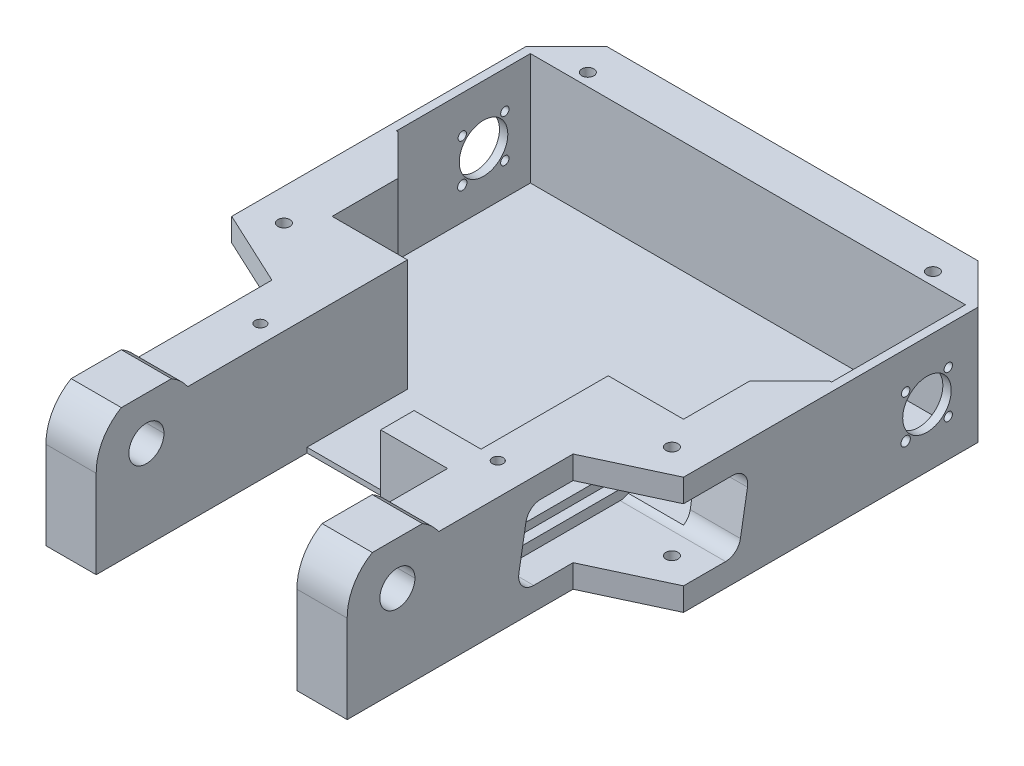
from build123d import *

# Parameters (mm, degrees)
BOSS_EXTRUDE1_DEPTH      = 30
BOSS_EXTRUDE2_DEPTH      = 5
BOSS_EXTRUDE3_DEPTH      = 15
BOSS_EXTRUDE6_START      = -75
BOSS_EXTRUDE6_DEPTH      = 15
CUT_EXTRUDE17_DEPTH      = 121.571555518
CUT_EXTRUDE17_DEPTH_BACK = 121.571555518
SKETCH5_R                = 5.25
CUT_EXTRUDE1_DEPTH       = 100
SKETCH6_W                = 40
SKETCH6_H                = 30
CUT_EXTRUDE2_DEPTH       = 13
CUT_EXTRUDE5_DEPTH       = 156.689595028
CUT_EXTRUDE5_DEPTH_BACK  = 156.689595028
SKETCH11_R               = 1.25
SKETCH11_R_2             = 1.396539859
SKETCH11_R_3             = 7.25
CUT_EXTRUDE6_DEPTH       = 65
CUT_EXTRUDE6_DEPTH_BACK  = 65
SKETCH12_W               = 40
SKETCH12_H               = 30
BOSS_EXTRUDE7_START      = 30
BOSS_EXTRUDE7_DEPTH      = 6
CUT_EXTRUDE7_DEPTH       = 120.981248535
CUT_EXTRUDE9_START       = 36
CUT_EXTRUDE9_DEPTH       = 31.5
CUT_EXTRUDE10_DEPTH      = 30
CUT_EXTRUDE11_START      = -67.5
CUT_EXTRUDE11_DEPTH      = 32.5
CHAMFER1_SIZE            = 12
CUT_EXTRUDE12_DEPTH      = 64.5
CUT_EXTRUDE12_DEPTH_BACK = 64.5
CHAMFER2_SIZE            = 16
CHAMFER2_SIZE_2          = 12
CUT_EXTRUDE14_START      = -3.5
CUT_EXTRUDE14_DEPTH      = 3.5
CUT_EXTRUDE15_START      = -30
CUT_EXTRUDE15_DEPTH      = 40
M3_CLEARANCE_HOLE2_D     = 3.6
M3_CLEARANCE_HOLE3_D     = 3.2


with BuildPart() as part:
    # Sketch1 → Boss-Extrude1 (new body)
    with BuildSketch(Plane(origin=(0, 0, 0), x_dir=(1, 0, 0), z_dir=(0, 1, 0))):
        Polygon((-30, -78), (-30, -48), (30, -48), (30, -78), (45, -78), (45, -25.491922308), (67.5, -15), (67.5, 85), (-67.5, 85), (-67.5, -15), (-45, -25.491922308), (-45, -78), align=None)
        Polygon((-30, -38), (-30, 0), (-52.5, 0), (-52.5, 70), (52.5, 70), (52.5, 0), (30, 0), (30, -38), align=None, mode=Mode.SUBTRACT)
    extrude(amount=BOSS_EXTRUDE1_DEPTH)

    # Sketch2 → Boss-Extrude2 (add)
    with BuildSketch(Plane.XZ):
        Polygon((67.5, 15), (45, 25.491922308), (45, 78), (30, 78), (30, 48), (-30, 48), (-30, 78), (-45, 78), (-45, 25.491922308), (-67.5, 15), (-67.5, -85), (67.5, -85), align=None)
    extrude(amount=BOSS_EXTRUDE2_DEPTH)

    # Sketch3 → Boss-Extrude3 (add)
    with BuildSketch(Plane.ZY.offset(45)):
        with BuildLine():
            Line((65.640792906, 30), (78, 30))
            Line((78, 30), (78, 26.5))
            ThreePointArc((78, 26.5), (81.535533906, 25.035533906), (83, 21.5))
            ThreePointArc((83, 21.5), (81.535533906, 17.964466094), (78, 16.5))
            Line((78, 16.5), (78, -5))
            Line((78, -5), (92.997936538, -5))
            Line((92.997936538, -5), (92.997936538, 21.251203686))
            ThreePointArc((92.997936538, 21.251203686), (82.569035183, 35.787194179), (65.640792906, 30))
        make_face()
    extrude(amount=-BOSS_EXTRUDE3_DEPTH)

    # Sketch3<3> → Boss-Extrude6 (add)
    with BuildSketch(Plane.ZY.offset(45).offset(BOSS_EXTRUDE6_START)):
        with BuildLine():
            Line((65.640792906, 30), (78, 30))
            Line((78, 30), (78, 26.5))
            ThreePointArc((78, 26.5), (81.535533906, 25.035533906), (83, 21.5))
            ThreePointArc((83, 21.5), (81.535533906, 17.964466094), (78, 16.5))
            Line((78, 16.5), (78, -5))
            Line((78, -5), (92.997936538, -5))
            Line((92.997936538, -5), (92.997936538, 21.251203686))
            ThreePointArc((92.997936538, 21.251203686), (82.569035183, 35.787194179), (65.640792906, 30))
        make_face()
    extrude(amount=-BOSS_EXTRUDE6_DEPTH)

    # Sketch40 → Cut-Extrude17 (cut, two sides: drawn at the far end of the back side and taken through both)
    with BuildSketch(Plane(origin=(0, 0, 0), x_dir=(0, 0, -1), z_dir=(1, 0, 0)).offset(-CUT_EXTRUDE17_DEPTH_BACK)):
        with BuildLine():
            Line((-85.483314774, 34.5), (-70.516685226, 34.5))
            ThreePointArc((-70.516685226, 34.5), (-78, 36.5), (-85.483314774, 34.5))
        make_face()
    extrude(amount=CUT_EXTRUDE17_DEPTH + CUT_EXTRUDE17_DEPTH_BACK, mode=Mode.SUBTRACT)

    # Sketch5 → Cut-Extrude1 (cut)
    with BuildSketch(Plane(origin=(45, 0, 0), x_dir=(0, 0, -1), z_dir=(1, 0, 0))):
        with Locations((-78, 21.5)):
            Circle(SKETCH5_R)
    extrude(amount=-CUT_EXTRUDE1_DEPTH, mode=Mode.SUBTRACT)

    # Sketch6 → Cut-Extrude2 (cut)
    with BuildSketch(Plane.XY.offset(48)):
        with Locations((-10, 15)):
            Rectangle(SKETCH6_W, SKETCH6_H)
    extrude(amount=-CUT_EXTRUDE2_DEPTH, mode=Mode.SUBTRACT)

    # Sketch11 → Cut-Extrude5 (cut, two sides: drawn at the far end of the back side and taken through both)
    with BuildSketch(Plane.ZY.offset(-52.5).offset(-CUT_EXTRUDE5_DEPTH_BACK)):
        with Locations((-51.386038969, 18.863961031)):
            Circle(SKETCH11_R)
        with Locations((-51.386038969, 6.136038969)):
            Circle(SKETCH11_R_2)
        with Locations((-64.113961031, 6.136038969)):
            Circle(SKETCH11_R)
        with Locations((-57.75, 12.5)):
            Circle(SKETCH11_R_3)
        with Locations((-64.113961031, 18.863961031)):
            Circle(SKETCH11_R)
    extrude(amount=CUT_EXTRUDE5_DEPTH + CUT_EXTRUDE5_DEPTH_BACK, mode=Mode.SUBTRACT)

    # Sketch12 → Cut-Extrude6 (cut, two sides: drawn at the far end of the back side and taken through both)
    with BuildSketch(Plane(origin=(0, 0, 0), x_dir=(0, 0, -1), z_dir=(1, 0, 0)).offset(-CUT_EXTRUDE6_DEPTH_BACK)):
        with Locations((51.75, 15)):
            Rectangle(SKETCH12_W, SKETCH12_H)
    extrude(amount=CUT_EXTRUDE6_DEPTH + CUT_EXTRUDE6_DEPTH_BACK, mode=Mode.SUBTRACT)

    # Boss-Extrude7: read off the stored shape, not the designer's step
    # Boss-Extrude7 outline → Boss-Extrude7 (add)
    with BuildSketch(Plane.YZ.offset(BOSS_EXTRUDE7_START)):
        with BuildLine():
            ThreePointArc((2.591404725, 0), (3.891844576, -1.321901111), (5.614908146, -2.00718812))
            Line((5.614908146, -2.00718812), (17.853487316, -4.120758536))
            ThreePointArc((17.853487316, -4.120758536), (21.396126568, -3.227468677), (23.108348979, 0))
            Line((23.108348979, 0), (20.086141399, 0))
            ThreePointArc((20.086141399, 0), (18.619289585, -1.18639873), (17.152437771, 0))
            Line((17.152437771, 0), (2.591404725, 0))
        make_face()
    extrude(amount=BOSS_EXTRUDE7_DEPTH)

    # Sketch20<3> (on Right Plane) → Cut-Extrude7 (cut, through all)
    with BuildSketch(Plane(origin=(0, 0, 0), x_dir=(0, 0, -1), z_dir=(1, 0, 0))):
        with BuildLine():
            Line((-30, 14.625), (-7.580257652, 14.625))
            ThreePointArc((-7.580257652, 14.625), (-5.455257652, 12.5), (-7.580257652, 10.375))
            Line((-7.580257652, 10.375), (-30, 10.375))
            ThreePointArc((-30, 10.375), (-32.125, 12.5), (-30, 14.625))
        make_face()
        with BuildLine():
            Line((-35.153085966, 20.119289585), (-0.31360127, 20.119289585))
            ThreePointArc((-0.31360127, 20.119289585), (1.18639873, 18.619289585), (-0.31360127, 17.119289585))
            Line((-0.31360127, 17.119289585), (-35.153085966, 17.119289585))
            ThreePointArc((-35.153085966, 17.119289585), (-36.653085966, 18.619289585), (-35.153085966, 20.119289585))
        make_face()
        with BuildLine():
            Line((-37.266656382, 7.880710415), (-2.427171685, 7.880710415))
            ThreePointArc((-2.427171685, 7.880710415), (-0.927171685, 6.380710415), (-2.427171685, 4.880710415))
            Line((-2.427171685, 4.880710415), (-37.266656382, 4.880710415))
            ThreePointArc((-37.266656382, 4.880710415), (-38.766656382, 6.380710415), (-37.266656382, 7.880710415))
        make_face()
    extrude(amount=CUT_EXTRUDE7_DEPTH, mode=Mode.SUBTRACT)

    # Cut-Extrude9: read off the stored shape, not the designer's step
    # Cut-Extrude9 outline → Cut-Extrude9 (cut)
    with BuildSketch(Plane.YZ.offset(CUT_EXTRUDE9_START)):
        with BuildLine():
            ThreePointArc((23.119289585, 35.153085966), (22.061389976, 38.051696822), (19.385091854, 39.587445772))
            Line((19.385091854, 39.587445772), (7.146512684, 41.701016188))
            ThreePointArc((7.146512684, 41.701016188), (3.482099559, 40.708756774), (1.880710415, 37.266656382))
            Line((1.880710415, 37.266656382), (1.880710415, 2.427171685))
            ThreePointArc((1.880710415, 2.427171685), (2.938610024, -0.471439171), (5.614908146, -2.00718812))
            Line((5.614908146, -2.00718812), (17.853487316, -4.120758536))
            ThreePointArc((17.853487316, -4.120758536), (21.517900441, -3.128499122), (23.119289585, 0.31360127))
            Line((23.119289585, 0.31360127), (23.119289585, 35.153085966))
        make_face()
        with BuildLine():
            ThreePointArc((20.119289585, 0.31360127), (18.619289585, -1.18639873), (17.119289585, 0.31360127))
            Line((17.119289585, 0.31360127), (17.119289585, 35.153085966))
            ThreePointArc((17.119289585, 35.153085966), (18.619289585, 36.653085966), (20.119289585, 35.153085966))
            Line((20.119289585, 35.153085966), (20.119289585, 0.31360127))
        make_face(mode=Mode.SUBTRACT)
        with BuildLine():
            Line((7.880710415, 37.266656382), (7.880710415, 2.427171685))
            ThreePointArc((7.880710415, 2.427171685), (6.380710415, 0.927171685), (4.880710415, 2.427171685))
            Line((4.880710415, 2.427171685), (4.880710415, 37.266656382))
            ThreePointArc((4.880710415, 37.266656382), (6.380710415, 38.766656382), (7.880710415, 37.266656382))
        make_face(mode=Mode.SUBTRACT)
        with BuildLine():
            Line((14.625, 30), (14.625, 7.580257652))
            ThreePointArc((14.625, 7.580257652), (12.5, 5.455257652), (10.375, 7.580257652))
            Line((10.375, 7.580257652), (10.375, 30))
            ThreePointArc((10.375, 30), (12.5, 32.125), (14.625, 30))
        make_face(mode=Mode.SUBTRACT)
    extrude(amount=CUT_EXTRUDE9_DEPTH, mode=Mode.SUBTRACT)

    # Sketch20<7> (on Right Plane) → Cut-Extrude10 (cut)
    with BuildSketch(Plane(origin=(0, 0, 0), x_dir=(0, 0, -1), z_dir=(1, 0, 0))):
        with BuildLine():
            Line((-30, 28.5), (-7.580257652, 28.5))
            ThreePointArc((-7.580257652, 28.5), (8.419742348, 12.5), (-7.580257652, -3.5))
            Line((-7.580257652, -3.5), (-30, -3.5))
            ThreePointArc((-30, -3.5), (-46, 12.5), (-30, 28.5))
        make_face()
    extrude(amount=CUT_EXTRUDE10_DEPTH, mode=Mode.SUBTRACT)

    # Cut-Extrude11: read off the stored shape, not the designer's step
    # Cut-Extrude11 outline → Cut-Extrude11 (cut)
    with BuildSketch(Plane.YZ.offset(CUT_EXTRUDE11_START)):
        with BuildLine():
            ThreePointArc((23.119289585, 35.153085966), (22.061389976, 38.051696822), (19.385091854, 39.587445772))
            Line((19.385091854, 39.587445772), (7.146512684, 41.701016188))
            ThreePointArc((7.146512684, 41.701016188), (3.482099559, 40.708756774), (1.880710415, 37.266656382))
            Line((1.880710415, 37.266656382), (1.880710415, 2.427171685))
            ThreePointArc((1.880710415, 2.427171685), (2.938610024, -0.471439171), (5.614908146, -2.00718812))
            Line((5.614908146, -2.00718812), (17.853487316, -4.120758536))
            ThreePointArc((17.853487316, -4.120758536), (21.517900441, -3.128499122), (23.119289585, 0.31360127))
            Line((23.119289585, 0.31360127), (23.119289585, 35.153085966))
        make_face()
    extrude(amount=CUT_EXTRUDE11_DEPTH, mode=Mode.SUBTRACT)

    # Chamfer1
    chamfer1_edges = [part.edges().sort_by_distance(p)[0] for p in [
        (-52.5, 15, -31.75),
        (52.5, 15, -31.75),
        (-67.5, 12.5, -85),
        (67.5, 12.5, -85),
    ]]
    chamfer(chamfer1_edges, length=CHAMFER1_SIZE)

    # Sketch23 → Cut-Extrude12 (cut, two sides: drawn at the far end of the back side and taken through both)
    with BuildSketch(Plane(origin=(0, 0, 0), x_dir=(0, 0, -1), z_dir=(1, 0, 0)).offset(-CUT_EXTRUDE12_DEPTH_BACK)):
        with BuildLine():
            Line((9.047824987, 17.002595906), (6.975008259, 5))
            Line((6.975008259, 5), (14.75, 5))
            Line((14.75, 5), (14.75, 25))
            Line((14.75, 25), (6.724618292, 25))
            ThreePointArc((6.724618292, 25), (8.809266361, 21.269437921), (9.047824987, 17.002595906))
        make_face()
    extrude(amount=CUT_EXTRUDE12_DEPTH + CUT_EXTRUDE12_DEPTH_BACK, mode=Mode.SUBTRACT)

    # Chamfer2
    # the kernel refuses this chamfer: 16, 12 mm, written as the material it adds along each edge
    with BuildSketch(Plane(origin=(-52.5, 25, -14.75), x_dir=(0, 0, 1), z_dir=(-1, 0, 0))) as chamfer2_piece_1:
        Polygon((CHAMFER2_SIZE, 0), (0, -CHAMFER2_SIZE_2), (0, 0), align=None)
    extrude(amount=12)
    with BuildSketch(Plane(origin=(64.5, 25, -14.75), x_dir=(0, -1, 0), z_dir=(-1, 0, 0))) as chamfer2_piece_2:
        Polygon((CHAMFER2_SIZE_2, 0), (0, CHAMFER2_SIZE), (0, 0), align=None)
    extrude(amount=12)

    # Cut-Extrude14: read off the stored shape, not the designer's step
    # Cut-Extrude14 outline → Cut-Extrude14 (cut)
    with BuildSketch(Plane(origin=(0, 0, 0), x_dir=(1, 0, 0), z_dir=(0, 1, 0)).offset(CUT_EXTRUDE14_START)):
        Polygon((0, -30), (30, -30), (30, 0), (52.5, 0), (52.5, 19.75), (64.5, 31.75), (65, 31.75), (65, 71.75), (-65, 71.75), (-65, 31.75), (-64.5, 31.75), (-52.5, 19.75), (-52.5, 0), (-30, 0), (-30, -48), (10, -48), (10, -39.987492178), (0, -39.987492178), align=None)
    extrude(amount=CUT_EXTRUDE14_DEPTH, mode=Mode.SUBTRACT)

    # Cut-Extrude15: read off the stored shape, not the designer's step
    # Cut-Extrude15 outline → Cut-Extrude15 (cut)
    with BuildSketch(Plane.YZ.offset(CUT_EXTRUDE15_START)):
        with BuildLine():
            Line((-5, 30), (-3.5, 30))
            ThreePointArc((-3.5, 30), (-2.599668871, 35.291502622), (0, 39.987492178))
            Line((0, 39.987492178), (-3.5, 39.987492178))
            Line((-3.5, 39.987492178), (-3.5, 48))
            Line((-3.5, 48), (-5, 48))
            Line((-5, 48), (-5, 30))
        make_face()
    extrude(amount=CUT_EXTRUDE15_DEPTH, mode=Mode.SUBTRACT)

    # M3 Clearance Hole2 (through all)
    with Locations(Plane(origin=(0, 30, 0), x_dir=(1, 0, 0), z_dir=(0, 1, 0))):
        with Locations((-57.975, -8.931905766), (57.975, -8.931905766), (51.554615818, 75.475), (-51.554615818, 75.475)):
            Hole(M3_CLEARANCE_HOLE2_D / 2)

    # M3 Clearance Hole3 (through all)
    with Locations(Plane(origin=(0, 30, 0), x_dir=(1, 0, 0), z_dir=(0, 1, 0))):
        with Locations((-35.475, -38.475), (35.475, -38.475)):
            Hole(M3_CLEARANCE_HOLE3_D / 2)


solid = part.part
